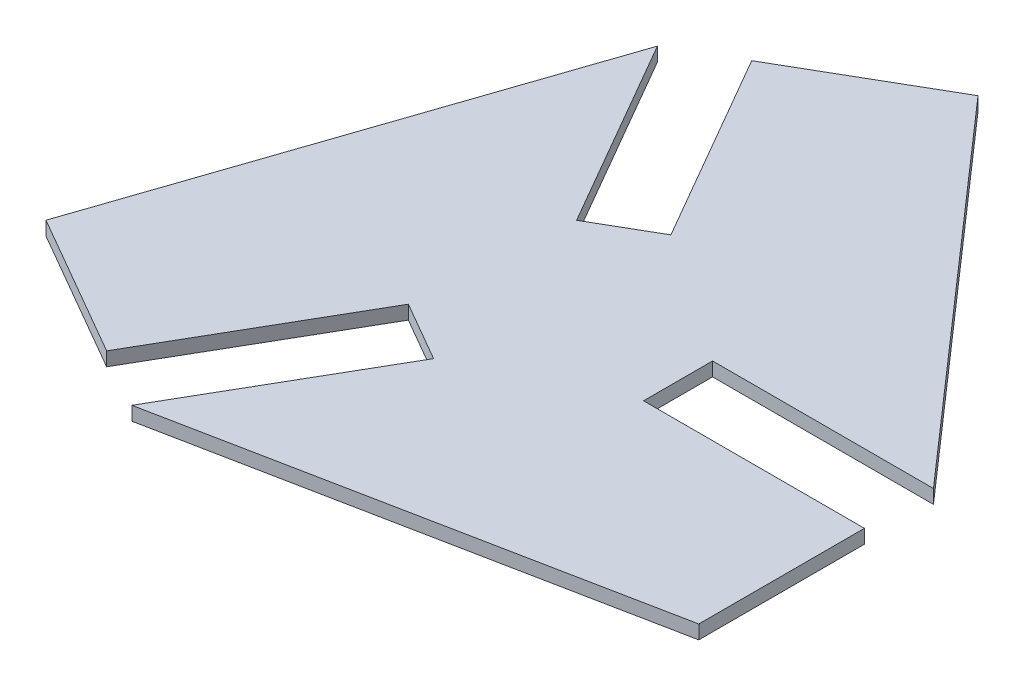
from build123d import *

# Parameters (mm, degrees)
BOSS_EXTRUDE2_DEPTH = 3.175


with BuildPart() as part:
    # Sketch1 → Boss-Extrude2 (new body)
    with BuildSketch(Plane(origin=(0, 0, 0), x_dir=(1, 0, 0), z_dir=(0, 1, 0))):
        Polygon((76.2, -47.5615), (-32.545746073, -69.197885768), (-7.145746073, -25.203795256), (-20.893899358, -17.266295256), (-46.293899358, -61.260385768), (-79.289467242, -42.210385768), (-43.654253927, 62.784385768), (-18.254253927, 18.790295256), (-4.506100642, 26.727795256), (-29.906100642, 70.721885768), (3.089467242, 89.771885768), (76.2, 6.4135), (25.4, 6.4135), (25.4, -9.4615), (76.2, -9.4615), align=None)
    extrude(amount=BOSS_EXTRUDE2_DEPTH)


solid = part.part
